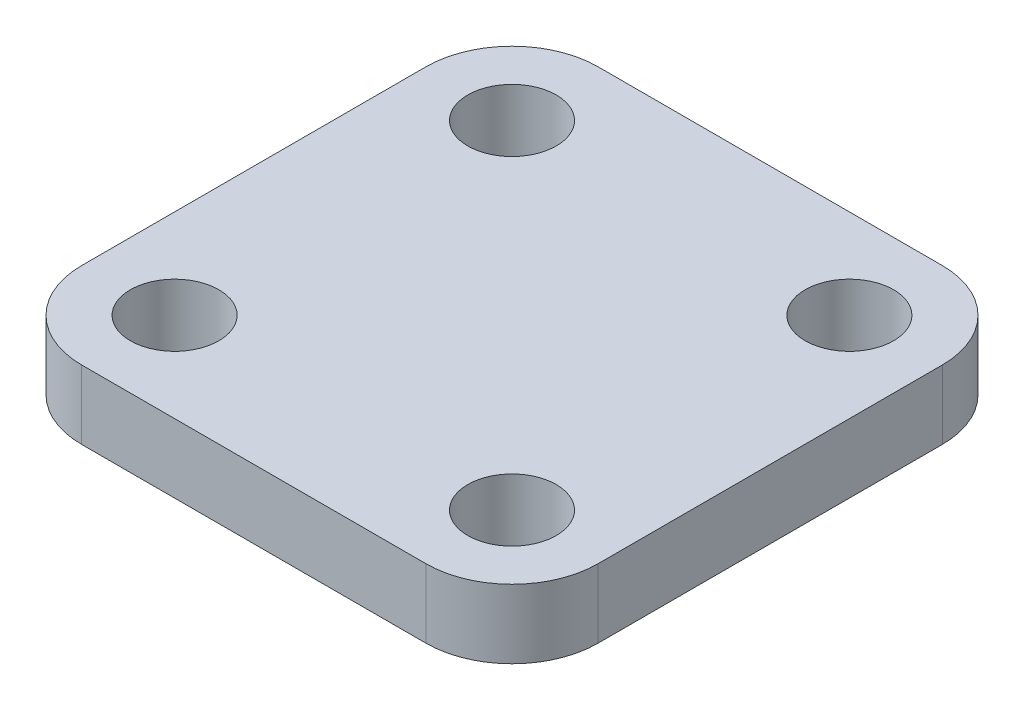
from build123d import *

# Parameters (mm, degrees)
SKETCH1_R           = 1.63195
BOSS_EXTRUDE1_DEPTH = 2.54


with BuildPart() as part:
    # Sketch1 → Boss-Extrude1 (new body)
    with BuildSketch(Plane(origin=(0, 0, 0), x_dir=(1, 0, 0), z_dir=(0, 1, 0))):
        with BuildLine():
            Line((-6.35, 9.525), (6.35, 9.525))
            ThreePointArc((6.35, 9.525), (8.59506403, 8.59506403), (9.525, 6.35))
            Line((9.525, 6.35), (9.525, -6.35))
            ThreePointArc((9.525, -6.35), (8.59506403, -8.59506403), (6.35, -9.525))
            Line((6.35, -9.525), (-6.35, -9.525))
            ThreePointArc((-6.35, -9.525), (-8.59506403, -8.59506403), (-9.525, -6.35))
            Line((-9.525, -6.35), (-9.525, 6.35))
            ThreePointArc((-9.525, 6.35), (-8.59506403, 8.59506403), (-6.35, 9.525))
        make_face()
        with Locations((6.223, 6.223)):
            Circle(SKETCH1_R, mode=Mode.SUBTRACT)
        with Locations((6.223, -6.223)):
            Circle(SKETCH1_R, mode=Mode.SUBTRACT)
        with Locations((-6.223, -6.223)):
            Circle(SKETCH1_R, mode=Mode.SUBTRACT)
        with Locations((-6.223, 6.223)):
            Circle(SKETCH1_R, mode=Mode.SUBTRACT)
    extrude(amount=BOSS_EXTRUDE1_DEPTH)


solid = part.part
